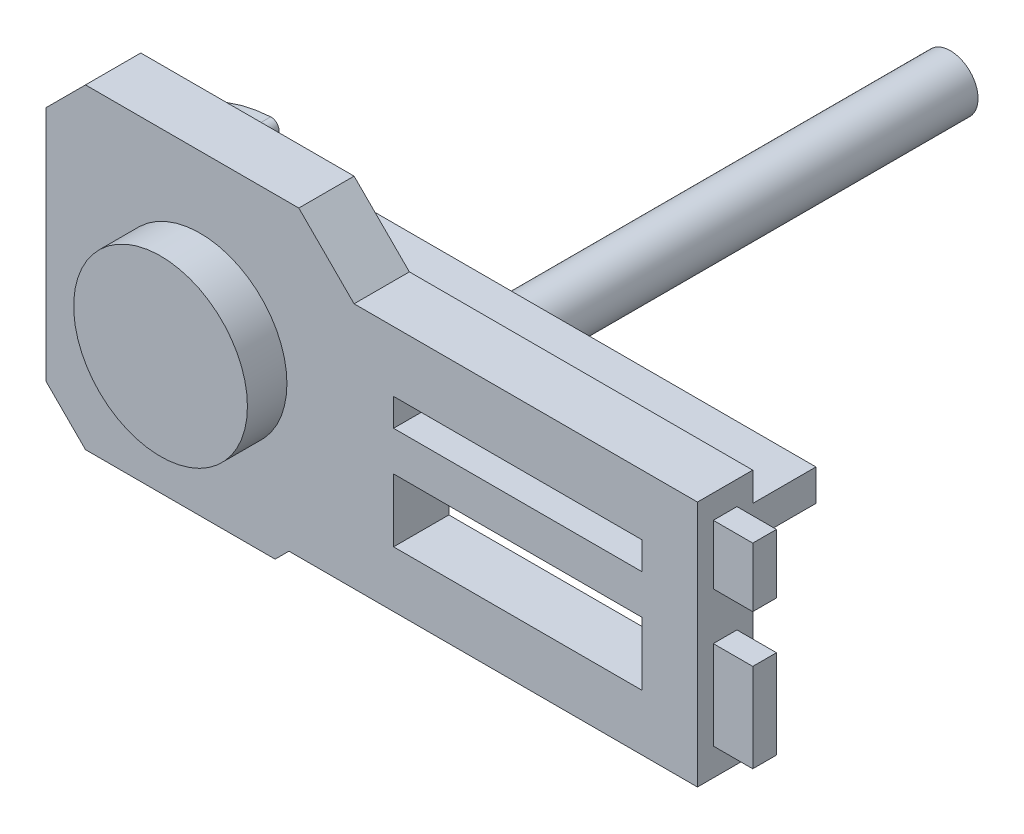
from build123d import *

# Parameters (mm, degrees)
SKETCH1_R               = 5.35
BOSS_EXTRUDE2_DEPTH     = 7
BOSS_EXTRUDE3_START     = 8
SKETCH3_R               = 5.35
BOSS_EXTRUDE3_DEPTH     = 8
BOSS_EXTRUDE4_DEPTH     = 3
FILLET1_R               = 1
CHAMFER1_SIZE           = 10
CHAMFER2_SIZE           = 5
CUT_EXTRUDE1_DEPTH      = 67.560662475
CUT_EXTRUDE1_DEPTH_BACK = 67.560662475
SKETCH5_W               = 31.474956737
SKETCH5_H               = 3.5
SKETCH5_H_2             = 8
CHAMFER3_SIZE           = 7
SKETCH6_R               = 11
BOSS_EXTRUDE5_DEPTH     = 5
SKETCH8_W               = 3
SKETCH8_H               = 7.519820499
SKETCH8_H_2             = 11.230179501
BOSS_EXTRUDE6_DEPTH     = 5
SKETCH9_R               = 3.5
BOSS_EXTRUDE7_DEPTH     = 68
CUT_EXTRUDE2_REACH      = 124.259
SKETCH10_W              = 8
SKETCH10_H              = 4


# Some blends are built 0.0001 mm under size
with BuildPart() as part:
    # Sketch1 → Boss-Extrude2 (new body)
    with BuildSketch(Plane.XY):
        Polygon((-19.503784034, -20), (19.503784034, -20), (19.503784034, -18.25), (62.978740771, -18.25), (62.978740771, 13), (19.503784034, 13), (19.503784034, 20), (-19.503784034, 20), align=None)
        Circle(SKETCH1_R, mode=Mode.SUBTRACT)
    extrude(amount=-BOSS_EXTRUDE2_DEPTH)

    # Sketch3 → Boss-Extrude3 (add)
    with BuildSketch(Plane.XY.offset(BOSS_EXTRUDE3_START)):
        with BuildLine():
            Line((7.668115805, 5.35), (62.978740771, 5.35))
            Line((62.978740771, 5.35), (62.978740771, 9.35))
            Line((62.978740771, 9.35), (0, 9.35))
            ThreePointArc((0, 9.35), (-9.35, 0), (0, -9.35))
            Line((0, -9.35), (62.978740771, -9.35))
            Line((62.978740771, -9.35), (62.978740771, -5.35))
            Line((62.978740771, -5.35), (7.668115805, -5.35))
            ThreePointArc((7.668115805, -5.35), (9.35, 0), (7.668115805, 5.35))
        make_face()
        Circle(SKETCH3_R, mode=Mode.SUBTRACT)
    extrude(amount=-BOSS_EXTRUDE3_DEPTH)

    # Sketch4 → Boss-Extrude4 (add)
    with BuildSketch(Plane.XY):
        with BuildLine():
            Line((0, -18.25), (62.978740771, -18.25))
            Line((62.978740771, -18.25), (62.978740771, -16.25))
            Line((62.978740771, -16.25), (8.306623863, -16.25))
            Line((8.306623863, -16.25), (0, -16.25))
            ThreePointArc((0, -16.25), (-16.25, 0), (0, 16.25))
            Line((0, 16.25), (0, 18.25))
            ThreePointArc((0, 18.25), (-18.25, 0), (0, -18.25))
        make_face()
    extrude(amount=BOSS_EXTRUDE4_DEPTH)

    # Fillet1
    fillet1_edges = [part.edges().sort_by_distance(p)[0] for p in [
        (0, 16.25, 1.5),
        (0, 18.25, 1.5),
    ]]
    fillet(fillet1_edges, radius=FILLET1_R - 0.0001)  # a hair under: the kernel refuses the full size

    # Chamfer1
    # the kernel refuses this chamfer: 10 mm, written as the material it takes off along each edge
    with BuildSketch(Plane(origin=(19.503784034, -20, 25.71682988), x_dir=(0.027495876610586317, 0.9996219169112968, 0), z_dir=(0, 0, -1))) as chamfer1_piece_1_section:
        Polygon((CHAMFER1_SIZE * 0.999621916911, -CHAMFER1_SIZE * 0.0274958766106), (-CHAMFER1_SIZE * 0.0274958766106, -CHAMFER1_SIZE * 0.999621916911), (0, 0), align=None)
    chamfer1_piece_1 = extrude(amount=58.433659759, mode=Mode.PRIVATE)
    chamfer1_piece_1 = split(chamfer1_piece_1, bisect_by=Plane(origin=(14.814200223, -18.25, -3.5), z_dir=(0, -1, 0)), keep=Keep.TOP, mode=Mode.PRIVATE)
    add(chamfer1_piece_1, mode=Mode.SUBTRACT)

    # Chamfer2
    chamfer2_edges = [part.edges().sort_by_distance(p)[0] for p in [
        (-19.503784034, -20, -3.5),
        (-19.503784034, 20, -3.5),
    ]]
    chamfer(chamfer2_edges, length=CHAMFER2_SIZE)

    # Sketch5 → Cut-Extrude1 (cut, two sides: drawn at the far end of the back side and taken through both)
    with BuildSketch(Plane.XY.offset(-CUT_EXTRUDE1_DEPTH_BACK)):
        with Locations((40.241262403, 3.6)):
            Rectangle(SKETCH5_W, SKETCH5_H)
        with Locations((40.241262403, -7.15)):
            Rectangle(SKETCH5_W, SKETCH5_H_2)
    extrude(amount=CUT_EXTRUDE1_DEPTH + CUT_EXTRUDE1_DEPTH_BACK, mode=Mode.SUBTRACT)

    # Chamfer3
    chamfer3_edges = [part.edges().sort_by_distance(p)[0] for p in [
        (19.503784034, 20, -3.5),
    ]]
    chamfer(chamfer3_edges, length=CHAMFER3_SIZE - 0.0001)  # a hair under: the kernel refuses the full size


with BuildPart() as body_2:
    # Mirror9: mirrored copy
    add(part.part.mirror(Plane.XY.offset(-10)))

    # Sketch6 → Boss-Extrude5 (add)
    with BuildSketch(Plane.XY.offset(-13)):
        Circle(SKETCH6_R)
    extrude(amount=BOSS_EXTRUDE5_DEPTH)

    # Sketch8 → Boss-Extrude6 (add)
    with BuildSketch(Plane(origin=(62.978740771, 0, 0), x_dir=(0, 0, -1), z_dir=(1, 0, 0))):
        with Locations((16.5, 6.240089751)):
            Rectangle(SKETCH8_W, SKETCH8_H)
        with Locations((16.5, -9.13491025)):
            Rectangle(SKETCH8_W, SKETCH8_H_2)
    extrude(amount=BOSS_EXTRUDE6_DEPTH)

    # Sketch9 → Boss-Extrude7 (add)
    with BuildSketch(Plane(origin=(0, 0, -20), x_dir=(-1, 0, 0), z_dir=(0, 0, -1))):
        with Locations((-20.003784034, 0)):
            Circle(SKETCH9_R)
    extrude(amount=BOSS_EXTRUDE7_DEPTH)

    # Sketch10 → Cut-Extrude2 (cut, up to next)
    with BuildSketch(Plane(origin=(62.978740771, 0, 0), x_dir=(0, 0, -1), z_dir=(1, 0, 0)), mode=Mode.PRIVATE) as cut_extrude2_sk1:
        with Locations((24, -7.35)):
            Rectangle(SKETCH10_W, SKETCH10_H)
    cut_extrude2_tool1 = extrude(cut_extrude2_sk1.sketch, amount=-CUT_EXTRUDE2_REACH, mode=Mode.PRIVATE) & body_2.part
    add(cut_extrude2_tool1.solids().sort_by_distance((62.978741, -7.35, -24))[0], mode=Mode.SUBTRACT)


solid = body_2.part
